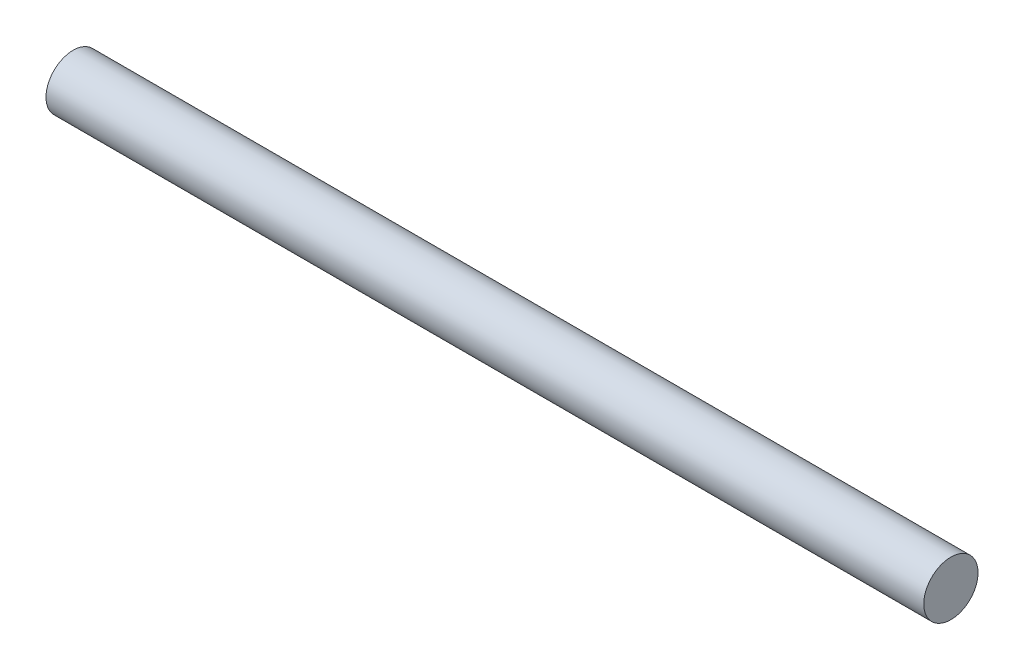
from build123d import *

# Parameters (mm, degrees)
SKETCH1_R           = 1.5
BOSS_EXTRUDE1_DEPTH = 24.25


with BuildPart() as part:
    # Sketch1 → Boss-Extrude1 (new, symmetric)
    with BuildSketch(Plane(origin=(0, 0, 0), x_dir=(0, 0, -1), z_dir=(1, 0, 0))):
        Circle(SKETCH1_R)
    extrude(amount=BOSS_EXTRUDE1_DEPTH, both=True)


solid = part.part
